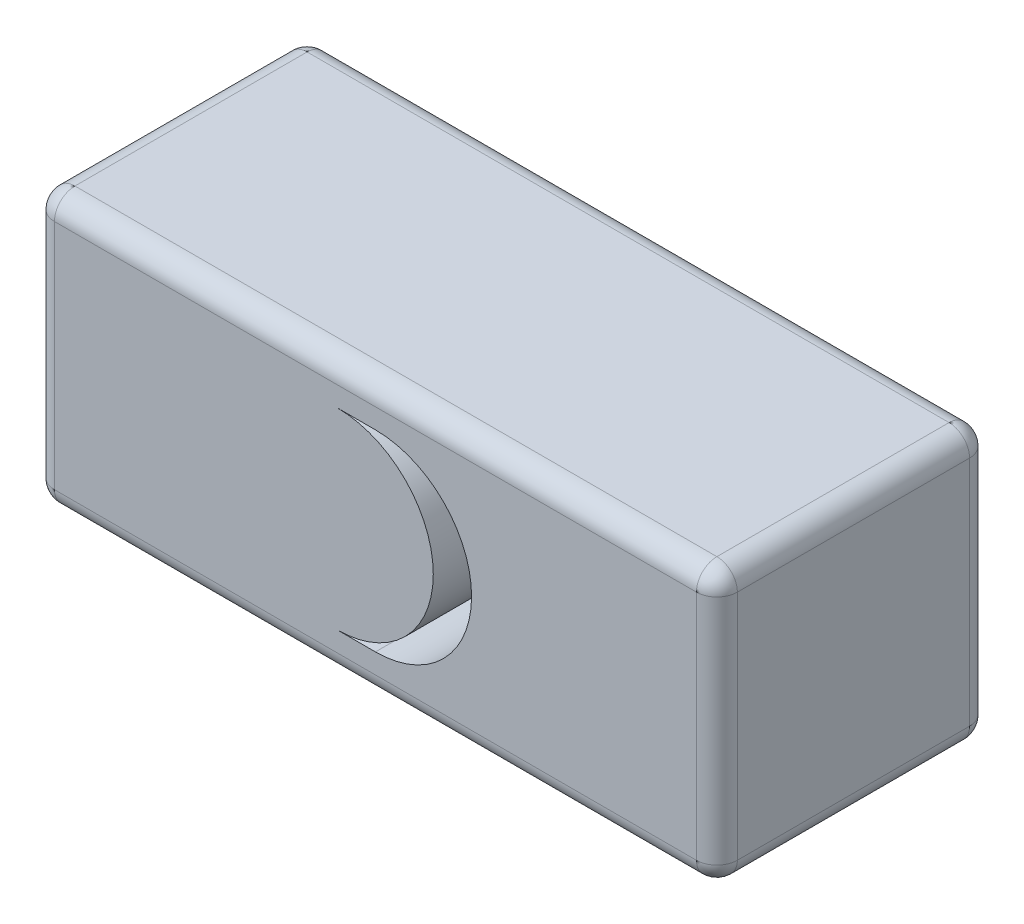
from build123d import *

# Parameters (mm, degrees)
BOSS_EXTRU_1_DEPTH      = 0.1
BOSS_EXTRU_1_DEPTH_BACK = 0.1
ESQUISSE1_W             = 0.5
ESQUISSE1_H             = 0.2
ENL_V_MAT_EXTRU_3_DEPTH = 1.335410197
CONG_1_R                = 0.015


with BuildPart() as part:
    # Esquisse1 → Boss.-Extru.1 (new, two sides: drawn at the far end of the back side and taken through both)
    with BuildSketch(Plane.XY.offset(-BOSS_EXTRU_1_DEPTH_BACK)):
        Rectangle(ESQUISSE1_W, ESQUISSE1_H)
    extrude(amount=BOSS_EXTRU_1_DEPTH + BOSS_EXTRU_1_DEPTH_BACK)

    # Esquisse2 → Enlèv. mat.-Extru.3 (cut, through all)
    with BuildSketch(Plane.XY.offset(0.1)):
        with BuildLine():
            Line((-0.028035468, 0.070399546), (0, 0.070399546))
            ThreePointArc((0, 0.070399546), (0.070399546, 0), (0, -0.070399546))
            Line((0, -0.070399546), (-0.028035468, -0.070399546))
            ThreePointArc((-0.028035468, -0.070399546), (0.042364078, 0), (-0.028035468, 0.070399546))
        make_face()
    extrude(amount=-ENL_V_MAT_EXTRU_3_DEPTH, mode=Mode.SUBTRACT)

    # Congé1
    cong_1_edges = [part.edges().sort_by_distance(p)[0] for p in [
        (0, -0.1, 0.1),
        (0, -0.1, -0.1),
        (-0.25, 0, 0.1),
        (-0.25, -0.1, 0),
        (-0.25, 0, -0.1),
        (0.25, -0.1, 0),
        (0.25, 0, 0.1),
        (0.25, 0, -0.1),
        (0.25, 0.1, 0),
        (0, 0.1, 0.1),
        (-0.25, 0.1, 0),
        (0, 0.1, -0.1),
    ]]
    fillet(cong_1_edges, radius=CONG_1_R)


solid = part.part
